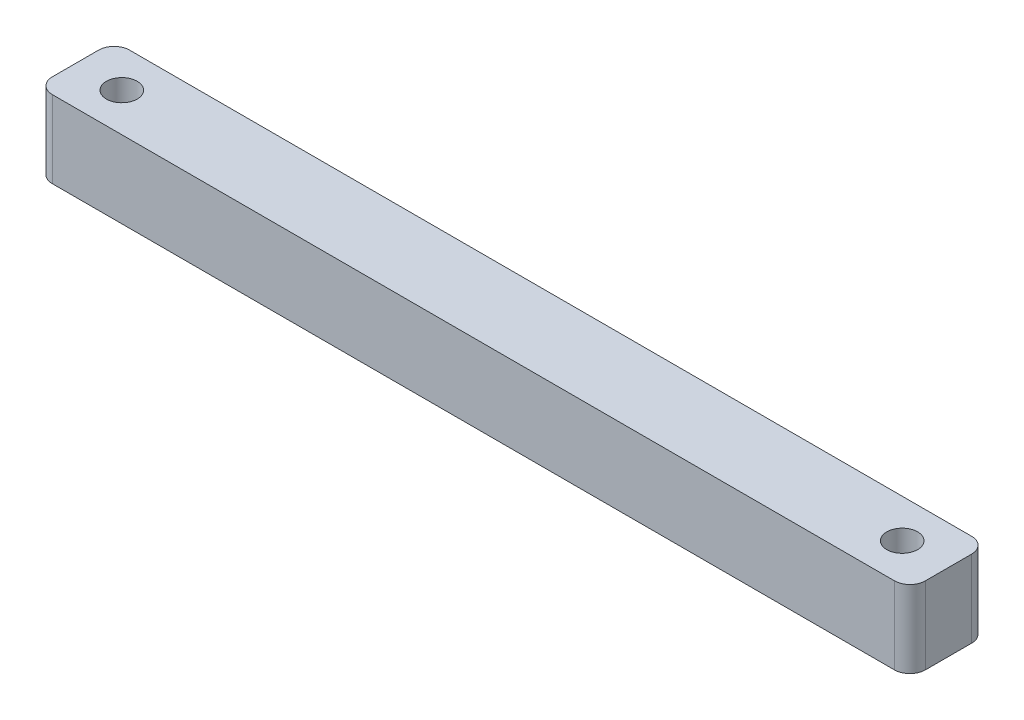
from build123d import *

# Parameters (mm, degrees)
SKETCH2_W           = 56.568542494
SKETCH2_H           = 5
BOSS_EXTRUDE1_DEPTH = 5
SKETCH3_R           = 1
CUT_EXTRUDE1_DEPTH  = 30.154759474
FILLET1_R           = 1


with BuildPart() as part:
    # Sketch2 → Boss-Extrude1 (new body)
    with BuildSketch(Plane.XY):
        Rectangle(SKETCH2_W, SKETCH2_H)
    extrude(amount=BOSS_EXTRUDE1_DEPTH)

    # Sketch3 → Cut-Extrude1 (cut, through all)
    with BuildSketch(Plane(origin=(0, 2.5, 0), x_dir=(1, 0, 0), z_dir=(0, 1, 0))):
        with Locations((-25.284271247, -2.5)):
            Circle(SKETCH3_R)
        with Locations((25.284271247, -2.5)):
            Circle(SKETCH3_R)
    extrude(amount=-CUT_EXTRUDE1_DEPTH, mode=Mode.SUBTRACT)

    # Fillet1
    fillet1_edges = [part.edges().sort_by_distance(p)[0] for p in [
        (-28.284271247, 0, 5),
        (-28.284271247, 0, 0),
        (28.284271247, 0, 5),
        (28.284271247, 0, 0),
    ]]
    fillet(fillet1_edges, radius=FILLET1_R)


solid = part.part
